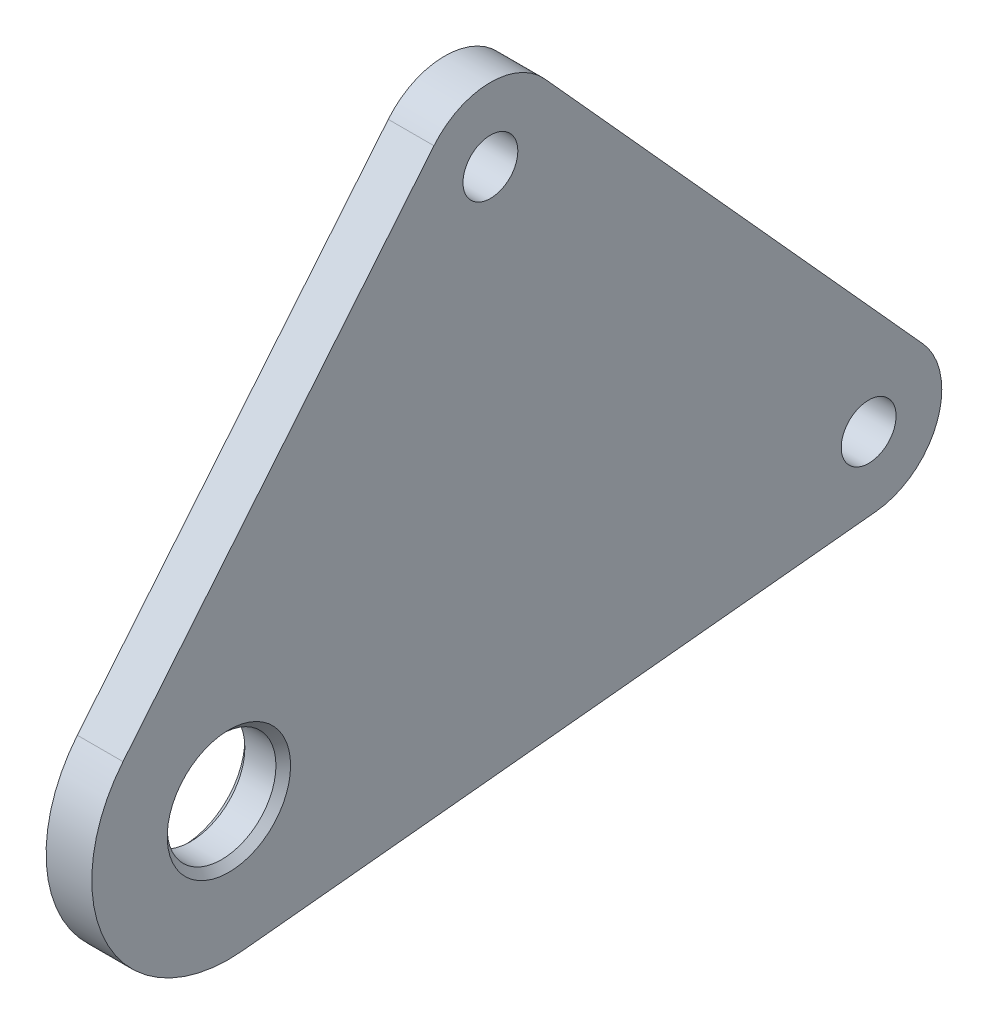
from build123d import *

# Parameters (mm, degrees)
SKETCH1_R           = 2.975
SKETCH1_R_2         = 1.5
BOSS_EXTRUDE1_DEPTH = 2.5
CHAMFER1_SIZE       = 0.4


with BuildPart() as part:
    # Sketch1 → Boss-Extrude1 (new body)
    with BuildSketch(Plane(origin=(0, 0, 0), x_dir=(0, 0, -1), z_dir=(1, 0, 0))):
        with BuildLine():
            Line((37.967717484, 2.681912179), (17.275537618, 25.579210775))
            ThreePointArc((17.275537618, 25.579210775), (14.215124199, 26.896224385), (11.21902238, 25.438819486))
            Line((11.21902238, 25.438819486), (-5.791495789, 4.765351668))
            ThreePointArc((-5.791495789, 4.765351668), (-6.613144713, -3.537840727), (0.75, -7.462405778))
            Line((0.75, -7.462405778), (35.4, -3.979949748))
            ThreePointArc((35.4, -3.979949748), (38.732356005, -1.438582167), (37.967717484, 2.681912179))
        make_face()
        Circle(SKETCH1_R, mode=Mode.SUBTRACT)
        with Locations((14.307820134, 22.897298596)):
            Circle(SKETCH1_R_2, mode=Mode.SUBTRACT)
        with Locations((35, 0)):
            Circle(SKETCH1_R_2, mode=Mode.SUBTRACT)
    extrude(amount=BOSS_EXTRUDE1_DEPTH)

    # Chamfer1
    chamfer1_edges = [part.edges().sort_by_distance(p)[0] for p in [
        (2.5, 0, 2.975),
        (0, 0, 2.975),
    ]]
    chamfer(chamfer1_edges, length=CHAMFER1_SIZE)


solid = part.part
